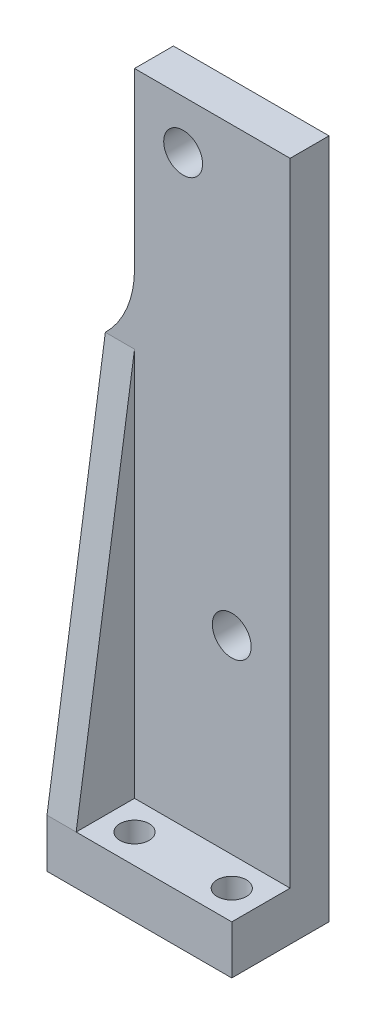
from build123d import *

# Parameters (mm, degrees)
SKETCH_1_W          = 16
SKETCH_1_H          = 6
SKETCH_1_R          = 1.5
EXTRUDE_1_DEPTH     = 5
SKETCH_2_W          = 16
SKETCH_2_H          = 70
EXTRUDE_2_DEPTH     = 4
SKETCH_3_R          = 2
CUT_EXTRUDE_1_DEPTH = 72.414284285
SKETCH_4_R          = 2
CUT_EXTRUDE_2_DEPTH = 72.414284285
SKETCH_5_R          = 3.5
CUT_EXTRUDE_3_DEPTH = 1
EXTRUDE_3_DEPTH     = 3
FILLET_1_R          = 10


with BuildPart() as part:
    # 草图1 → 凸台-拉伸1 (new body)
    with BuildSketch(Plane(origin=(0, 0, 0), x_dir=(1, 0, 0), z_dir=(0, 1, 0))):
        with Locations((-2, 0)):
            Rectangle(SKETCH_1_W, SKETCH_1_H)
        with Locations(Location((-7, 0, 0), (0, 0, 270))):
            Circle(SKETCH_1_R, mode=Mode.SUBTRACT)
        with Locations(Location((3, 0, 0), (0, 0, 270))):
            Circle(SKETCH_1_R, mode=Mode.SUBTRACT)
    extrude(amount=EXTRUDE_1_DEPTH)

    # 草图2 → 凸台-拉伸2 (add)
    with BuildSketch(Plane(origin=(0, 0, -3), x_dir=(-1, 0, 0), z_dir=(0, 0, -1))):
        with Locations((2, 35)):
            Rectangle(SKETCH_2_W, SKETCH_2_H)
    extrude(amount=EXTRUDE_2_DEPTH)

    # 草图3 → 切除-拉伸1 (cut, through all)
    with BuildSketch(Plane(origin=(0, 0, -7), x_dir=(-1, 0, 0), z_dir=(0, 0, -1))):
        with Locations((5, 65)):
            Circle(SKETCH_3_R)
    extrude(amount=-CUT_EXTRUDE_1_DEPTH, mode=Mode.SUBTRACT)

    # 草图4 → 切除-拉伸2 (cut, through all)
    with BuildSketch(Plane(origin=(0, 0, -7), x_dir=(-1, 0, 0), z_dir=(0, 0, -1))):
        with Locations((0, 24.5)):
            Circle(SKETCH_4_R)
    extrude(amount=-CUT_EXTRUDE_2_DEPTH, mode=Mode.SUBTRACT)

    # 草图5 → 切除-拉伸3 (cut)
    with BuildSketch(Plane(origin=(0, 0, -7), x_dir=(-1, 0, 0), z_dir=(0, 0, -1))):
        with Locations((5, 65)):
            Circle(SKETCH_5_R)
    extrude(amount=-CUT_EXTRUDE_3_DEPTH, mode=Mode.SUBTRACT)

    # 草图6 → 凸台-拉伸3 (add)
    with BuildSketch(Plane.ZY.offset(10)):
        Polygon((-3, 45), (-3, 5), (3, 5), align=None)
        Polygon((3, 5), (-3, 5), (-3, 45), (-7, 45), (-7, 0), (3, 0), align=None)
    extrude(amount=EXTRUDE_3_DEPTH)

    # 圆角1
    # the kernel refuses this fillet: 10 mm, written as the material it adds along each edge
    with BuildSketch(Plane(origin=(-10, 45, -3), x_dir=(-1, 0, 0), z_dir=(0, 0, -1))) as fillet_1_piece_1:
        with BuildLine():
            CenterArc((10, 7.141428429), FILLET_1_R, 180, 45.572995999)
            Line((0, 7.141428429), (0, 0))
            Line((0, 0), (3, 0))
        make_face()
    extrude(amount=4)


solid = part.part
